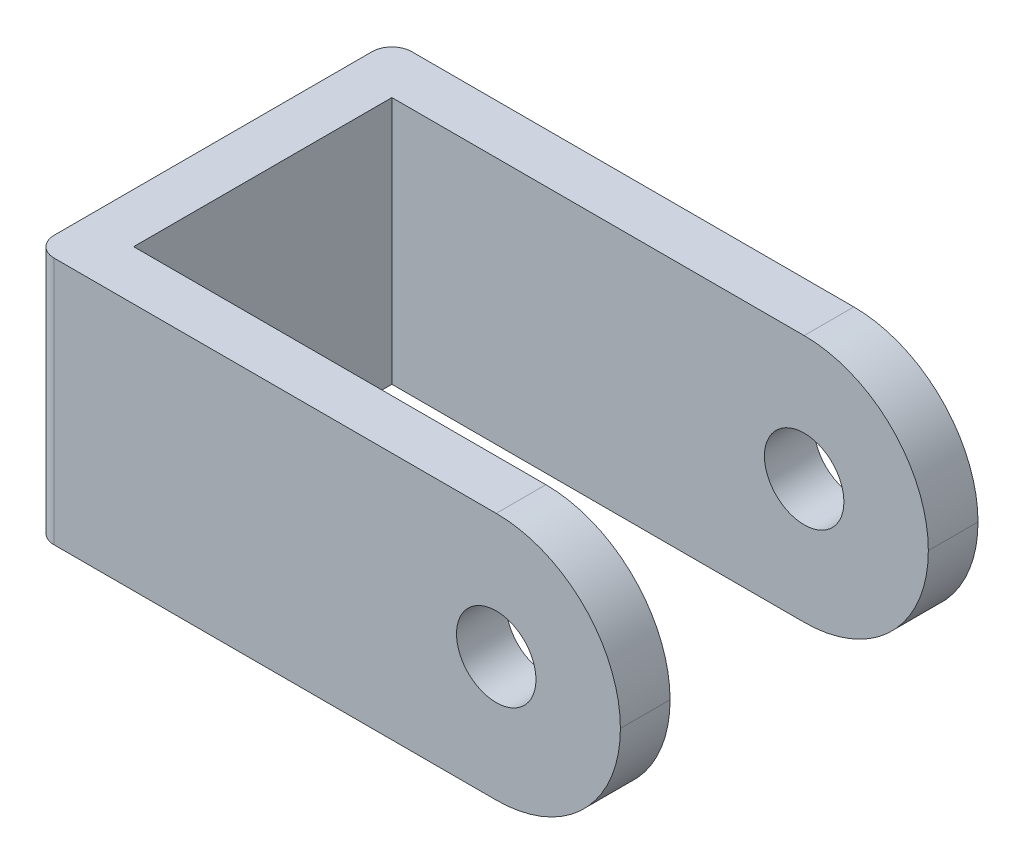
from build123d import *

# Parameters (mm, degrees)
EXTRUDE_1_DEPTH     = 25
FILLET_1_R          = 12.5
SKETCH_2_R          = 4
CUT_EXTRUDE_1_DEPTH = 74.4982993


with BuildPart() as part:
    # Эскиз1 → Бобышка-Вытянуть1 (new body)
    with BuildSketch(Plane(origin=(0, 0, 0), x_dir=(1, 0, 0), z_dir=(0, 1, 0))):
        with BuildLine():
            Line((0, 16), (0, -16))
            ThreePointArc((0, -16), (0.585786438, -17.414213562), (2, -18))
            Line((2, -18), (59, -18))
            Line((59, -18), (59, -13))
            Line((59, -13), (5, -13))
            Line((5, -13), (5, 13))
            Line((5, 13), (59, 13))
            Line((59, 13), (59, 18))
            Line((59, 18), (2, 18))
            ThreePointArc((2, 18), (0.585786438, 17.414213562), (0, 16))
        make_face()
    extrude(amount=EXTRUDE_1_DEPTH)

    # Скругление1
    fillet_1_edges = [part.edges().sort_by_distance(p)[0] for p in [
        (59, 25, -15.5),
        (59, 0, -15.5),
        (59, 0, 15.5),
        (59, 25, 15.5),
    ]]
    fillet(fillet_1_edges, radius=FILLET_1_R - 0.0001)  # a hair under: the kernel refuses the full size

    # Эскиз2 → Вырез-Вытянуть1 (cut, through all)
    with BuildSketch(Plane.XY.offset(18)):
        with Locations((46.5, 12.5)):
            Circle(SKETCH_2_R)
    extrude(amount=-CUT_EXTRUDE_1_DEPTH, mode=Mode.SUBTRACT)


solid = part.part
